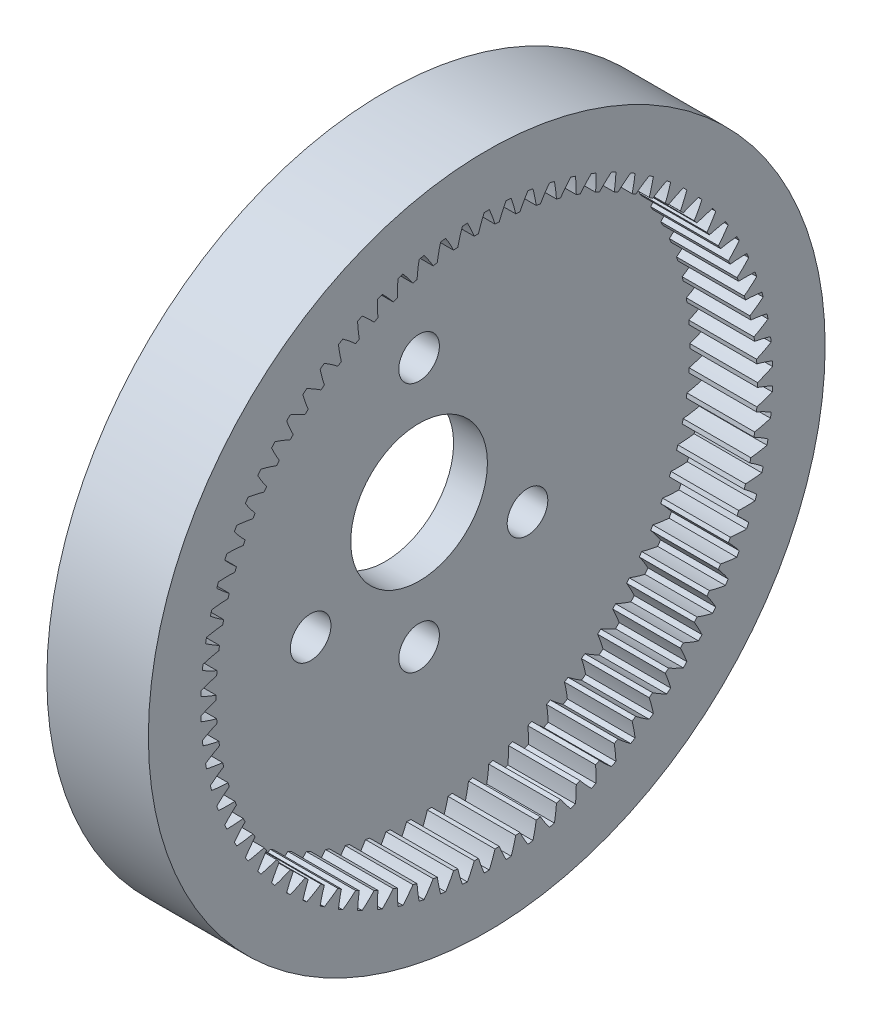
from build123d import *

# Parameters (mm, degrees)
BASPROSKE_W             = 12
BASPROSKE_H             = 5
TOOTHCUT_DEPTH          = 38.336309405
TEETHCUTS_COUNT         = 82
SKETCH2_R               = 25
BOSS_EXTRUDE1_DEPTH     = 2.5
CUT_EXTRUDE1_DEPTH      = 39.213217609
CUT_EXTRUDE1_DEPTH_BACK = 2.5
SKETCH3_R               = 5.05
SKETCH3_R_2             = 1.5
SKETCH4_R               = 25
CUT_EXTRUDE2_DEPTH      = 7


with BuildPart() as part:
    # BasProSke → Base-Revolve (revolve)
    with BuildSketch(Plane(origin=(0, 0, 0), x_dir=(1, 0, 0), z_dir=(0, 1, 0))):
        with Locations((6, 22.5)):
            Rectangle(BASPROSKE_W, BASPROSKE_H)
    revolve(axis=Axis((-10, 0, 0), (1, 0, 0)))

    # TooCutSke → ToothCut (cut, through all)
    with BuildSketch(Plane(origin=(0, 0, 0), x_dir=(0, 0, -1), z_dir=(1, 0, 0))):
        with BuildLine():
            ThreePointArc((0.616445603, 19.965085524), (0.419540464, 20.551600293), (0.187608392, 21.12516696))
            ThreePointArc((0.187608392, 21.12516696), (0, 21.126), (-0.187608392, 21.12516696))
            ThreePointArc((-0.187608392, 21.12516696), (-0.419540464, 20.551600293), (-0.616445603, 19.965085524))
            ThreePointArc((-0.616445603, 19.965085524), (0, 19.9746), (0.616445603, 19.965085524))
        make_face()
    toothcut = extrude(amount=TOOTHCUT_DEPTH, mode=Mode.SUBTRACT)

    # TeethCuts: ToothCut ×82 about axis
    teethcuts_axis = Axis((-10, 0, 0), (1, 0, 0))
    for i in range(1, TEETHCUTS_COUNT):
        add(toothcut.rotate(teethcuts_axis, i * 360 / TEETHCUTS_COUNT), mode=Mode.SUBTRACT)

    # Sketch2 → Boss-Extrude1 (add)
    with BuildSketch(Plane.ZY):
        Circle(SKETCH2_R)
    extrude(amount=BOSS_EXTRUDE1_DEPTH)

    # Sketch3 → Cut-Extrude1 (cut, two sides: drawn at the far end of the back side and taken through both)
    with BuildSketch(Plane.ZY.offset(2.5).offset(-CUT_EXTRUDE1_DEPTH_BACK)):
        Circle(SKETCH3_R)
        with Locations((0, 9.25)):
            Circle(SKETCH3_R_2)
        with Locations((0, -9.25)):
            Circle(SKETCH3_R_2)
        with Locations((8.010734985, -4.625)):
            Circle(SKETCH3_R_2)
        with Locations((-8.010734985, -4.625)):
            Circle(SKETCH3_R_2)
    extrude(amount=CUT_EXTRUDE1_DEPTH + CUT_EXTRUDE1_DEPTH_BACK, mode=Mode.SUBTRACT)

    # Sketch4 → Cut-Extrude2 (cut)
    with BuildSketch(Plane(origin=(12, 0, 0), x_dir=(0, 0, -1), z_dir=(1, 0, 0))):
        Circle(SKETCH4_R)
    extrude(amount=-CUT_EXTRUDE2_DEPTH, mode=Mode.SUBTRACT)


solid = part.part
